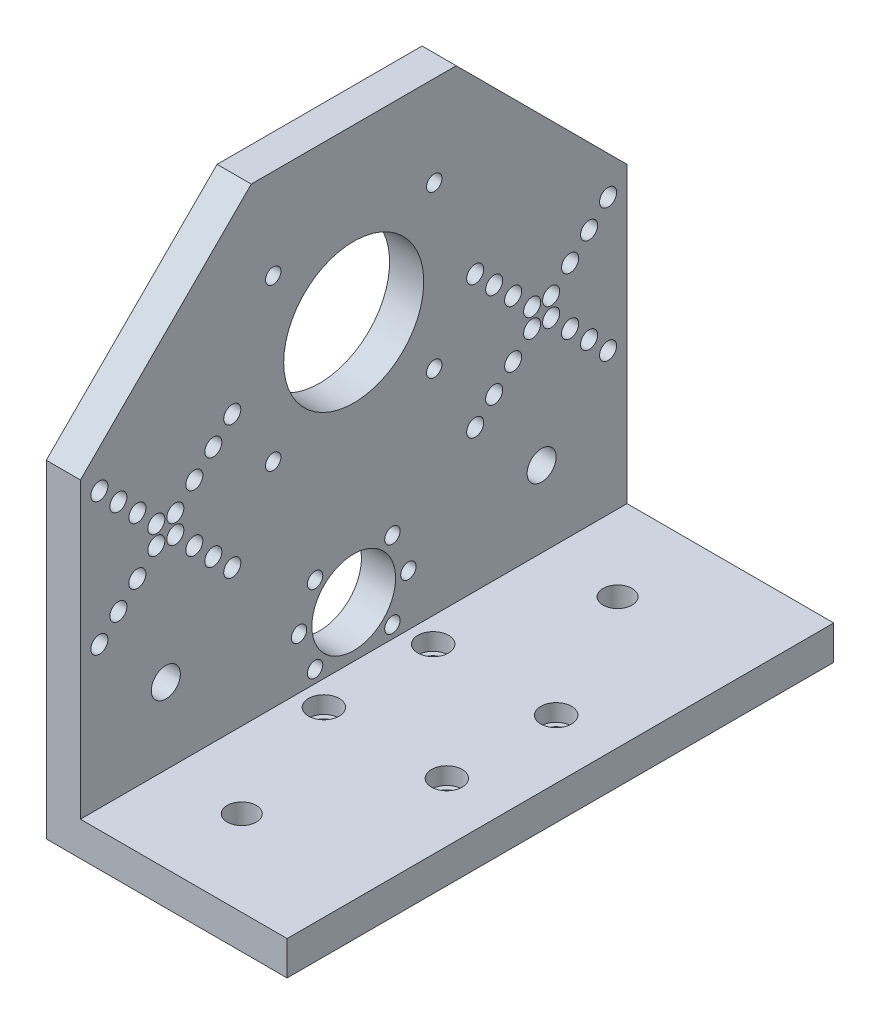
from build123d import *

# Parameters (mm, degrees)
SKETCH1_W           = 70.5
SKETCH1_H           = 60
SKETCH1_R           = 2.95
BOSS_EXTRUDE1_DEPTH = 10
SKETCH3_R           = 4.5
CUT_EXTRUDE1_DEPTH  = 5
SKETCH4_W           = 10
SKETCH4_H           = 60
BOSS_EXTRUDE3_DEPTH = 31
CUT_EXTRUDE2_REACH  = 103.248
SKETCH5_R           = 12.25
SKETCH5_R_2         = 2.25
SKETCH6_W           = 60
SKETCH6_H           = 31
SKETCH6_R           = 8
BOSS_EXTRUDE4_DEPTH = 5
SKETCH7_W           = 70.5
SKETCH7_H           = 60
BOSS_EXTRUDE5_DEPTH = 5
SKETCH8_W           = 60
SKETCH8_H           = 100
SKETCH8_R           = 2.25
SKETCH8_R_2         = 20.5
BOSS_EXTRUDE6_DEPTH = 10
CUT_EXTRUDE3_REACH  = 174.876
SKETCH10_W          = 50
SKETCH10_H          = 96
SKETCH10_R          = 2.5
BOSS_EXTRUDE7_DEPTH = 10
CHAMFER1_SIZE       = 50
SKETCH11_W          = 60.5
SKETCH11_H          = 50
BOSS_EXTRUDE8_DEPTH = 10
CUT_EXTRUDE4_REACH  = 194.552
SKETCH12_R          = 4.25
CUT_EXTRUDE6_REACH  = 190.59
SKETCH14_R          = 4.25


with BuildPart() as part:
    # Sketch1 → Boss-Extrude1 (new body)
    with BuildSketch(Plane(origin=(0, 0, 0), x_dir=(1, 0, 0), z_dir=(0, 1, 0))):
        with Locations((35.25, 30)):
            Rectangle(SKETCH1_W, SKETCH1_H)
        with Locations(Location((53.25, 46, 0), (0, 0, 270))):
            Circle(SKETCH1_R, mode=Mode.SUBTRACT)
        with Locations(Location((53.25, 14, 0), (0, 0, 270))):
            Circle(SKETCH1_R, mode=Mode.SUBTRACT)
        with Locations(Location((17.25, 46, 0), (0, 0, 270))):
            Circle(SKETCH1_R, mode=Mode.SUBTRACT)
        with Locations(Location((17.25, 14, 0), (0, 0, 270))):
            Circle(SKETCH1_R, mode=Mode.SUBTRACT)
    extrude(amount=BOSS_EXTRUDE1_DEPTH)

    # Sketch3 → Cut-Extrude1 (cut)
    with BuildSketch(Plane(origin=(0, 10, 0), x_dir=(1, 0, 0), z_dir=(0, 1, 0))):
        with Locations(Location((53.25, 46, 0), (0, 0, 270))):
            Circle(SKETCH3_R)
        with Locations(Location((53.25, 14, 0), (0, 0, 270))):
            Circle(SKETCH3_R)
        with Locations(Location((17.25, 46, 0), (0, 0, 270))):
            Circle(SKETCH3_R)
        with Locations(Location((17.25, 14, 0), (0, 0, 270))):
            Circle(SKETCH3_R)
    extrude(amount=-CUT_EXTRUDE1_DEPTH, mode=Mode.SUBTRACT)

    # Sketch4 → Boss-Extrude3 (add)
    with BuildSketch(Plane(origin=(0, 10, 0), x_dir=(1, 0, 0), z_dir=(0, 1, 0))):
        with Locations((5, 30)):
            Rectangle(SKETCH4_W, SKETCH4_H)
    extrude(amount=BOSS_EXTRUDE3_DEPTH)

    # Sketch5 → Cut-Extrude2 (cut, up to next)
    with BuildSketch(Plane.ZY, mode=Mode.PRIVATE) as cut_extrude2_sk1:
        with Locations((-30, 25)):
            Circle(SKETCH5_R)
    cut_extrude2_tool1 = extrude(cut_extrude2_sk1.sketch, amount=-CUT_EXTRUDE2_REACH, mode=Mode.PRIVATE) & part.part
    # Sketch5 → Cut-Extrude2 (cut, up to next)
    with BuildSketch(Plane.ZY, mode=Mode.PRIVATE) as cut_extrude2_sk2:
        with Locations((-14, 25)):
            Circle(SKETCH5_R_2)
    cut_extrude2_tool2 = extrude(cut_extrude2_sk2.sketch, amount=-CUT_EXTRUDE2_REACH, mode=Mode.PRIVATE) & part.part
    # Sketch5 → Cut-Extrude2 (cut, up to next)
    with BuildSketch(Plane.ZY, mode=Mode.PRIVATE) as cut_extrude2_sk3:
        with Locations((-18.686291501, 36.313708499)):
            Circle(SKETCH5_R_2)
    cut_extrude2_tool3 = extrude(cut_extrude2_sk3.sketch, amount=-CUT_EXTRUDE2_REACH, mode=Mode.PRIVATE) & part.part
    # Sketch5 → Cut-Extrude2 (cut, up to next)
    with BuildSketch(Plane.ZY, mode=Mode.PRIVATE) as cut_extrude2_sk4:
        with Locations((-18.686291501, 13.686291501)):
            Circle(SKETCH5_R_2)
    cut_extrude2_tool4 = extrude(cut_extrude2_sk4.sketch, amount=-CUT_EXTRUDE2_REACH, mode=Mode.PRIVATE) & part.part
    # Sketch5 → Cut-Extrude2 (cut, up to next)
    with BuildSketch(Plane.ZY, mode=Mode.PRIVATE) as cut_extrude2_sk5:
        with Locations((-41.313708499, 36.313708499)):
            Circle(SKETCH5_R_2)
    cut_extrude2_tool5 = extrude(cut_extrude2_sk5.sketch, amount=-CUT_EXTRUDE2_REACH, mode=Mode.PRIVATE) & part.part
    # Sketch5 → Cut-Extrude2 (cut, up to next)
    with BuildSketch(Plane.ZY, mode=Mode.PRIVATE) as cut_extrude2_sk6:
        with Locations((-46, 25)):
            Circle(SKETCH5_R_2)
    cut_extrude2_tool6 = extrude(cut_extrude2_sk6.sketch, amount=-CUT_EXTRUDE2_REACH, mode=Mode.PRIVATE) & part.part
    # Sketch5 → Cut-Extrude2 (cut, up to next)
    with BuildSketch(Plane.ZY, mode=Mode.PRIVATE) as cut_extrude2_sk7:
        with Locations((-41.313708499, 13.686291501)):
            Circle(SKETCH5_R_2)
    cut_extrude2_tool7 = extrude(cut_extrude2_sk7.sketch, amount=-CUT_EXTRUDE2_REACH, mode=Mode.PRIVATE) & part.part
    add(cut_extrude2_tool1.solids().sort_by_distance((0, 25, -30))[0], mode=Mode.SUBTRACT)
    add(cut_extrude2_tool2.solids().sort_by_distance((0, 25, -14))[0], mode=Mode.SUBTRACT)
    add(cut_extrude2_tool3.solids().sort_by_distance((0, 36.313708, -18.686292))[0], mode=Mode.SUBTRACT)
    add(cut_extrude2_tool4.solids().sort_by_distance((0, 13.686292, -18.686292))[0], mode=Mode.SUBTRACT)
    add(cut_extrude2_tool5.solids().sort_by_distance((0, 36.313708, -41.313708))[0], mode=Mode.SUBTRACT)
    add(cut_extrude2_tool6.solids().sort_by_distance((0, 25, -46))[0], mode=Mode.SUBTRACT)
    add(cut_extrude2_tool7.solids().sort_by_distance((0, 13.686292, -41.313708))[0], mode=Mode.SUBTRACT)

    # Sketch6 → Boss-Extrude4 (add)
    with BuildSketch(Plane(origin=(70.5, 0, 0), x_dir=(0, 0, -1), z_dir=(1, 0, 0))):
        with Locations((30, 25.5)):
            Rectangle(SKETCH6_W, SKETCH6_H)
        with Locations((30, 25)):
            Circle(SKETCH6_R, mode=Mode.SUBTRACT)
    extrude(amount=-BOSS_EXTRUDE4_DEPTH)

    # Sketch7 → Boss-Extrude5 (add)
    with BuildSketch(Plane(origin=(0, 41, 0), x_dir=(1, 0, 0), z_dir=(0, 1, 0))):
        with Locations((35.25, 30)):
            Rectangle(SKETCH7_W, SKETCH7_H)
    extrude(amount=BOSS_EXTRUDE5_DEPTH)

    # Sketch8 → Boss-Extrude6 (add)
    with BuildSketch(Plane.ZY):
        with Locations((-30, 96)):
            Rectangle(SKETCH8_W, SKETCH8_H)
        with Locations((-53.57, 72.43)):
            Circle(SKETCH8_R, mode=Mode.SUBTRACT)
        with Locations((-6.43, 72.43)):
            Circle(SKETCH8_R, mode=Mode.SUBTRACT)
        with Locations((-6.43, 119.57)):
            Circle(SKETCH8_R, mode=Mode.SUBTRACT)
        with Locations((-53.57, 119.57)):
            Circle(SKETCH8_R, mode=Mode.SUBTRACT)
        with Locations((-30, 96)):
            Circle(SKETCH8_R_2, mode=Mode.SUBTRACT)
    extrude(amount=-BOSS_EXTRUDE6_DEPTH)

    # Sketch9 → Cut-Extrude3 (cut, up to next)
    with BuildSketch(Plane.XY, mode=Mode.PRIVATE) as cut_extrude3_sk1:
        Polygon((10, 41), (65.5, 41), (65.5, 10), (70.5, 10), (70.5, 46), (10, 46), align=None)
    cut_extrude3_tool1 = extrude(cut_extrude3_sk1.sketch, amount=-CUT_EXTRUDE3_REACH, mode=Mode.PRIVATE) & part.part
    add(cut_extrude3_tool1.solids().sort_by_distance((37.75, 41.704006, 0))[0], mode=Mode.SUBTRACT)

    # Sketch10 → Boss-Extrude7 (add)
    with BuildSketch(Plane.ZY):
        with Locations((-85, 48)):
            Rectangle(SKETCH10_W, SKETCH10_H)
        with Locations((-65.555555556, 90.444444444)):
            Circle(SKETCH10_R, mode=Mode.SUBTRACT)
        with Locations((-104.444444444, 51.555555556)):
            Circle(SKETCH10_R, mode=Mode.SUBTRACT)
        with Locations((-98.888888889, 57.111111111)):
            Circle(SKETCH10_R, mode=Mode.SUBTRACT)
        with Locations((-93.333333333, 62.666666667)):
            Circle(SKETCH10_R, mode=Mode.SUBTRACT)
        with Locations((-87.777777778, 68.222222222)):
            Circle(SKETCH10_R, mode=Mode.SUBTRACT)
        with Locations((-87.777777778, 73.777777778)):
            Circle(SKETCH10_R, mode=Mode.SUBTRACT)
        with Locations((-98.888888889, 84.888888889)):
            Circle(SKETCH10_R, mode=Mode.SUBTRACT)
        with Locations((-104.444444444, 90.444444444)):
            Circle(SKETCH10_R, mode=Mode.SUBTRACT)
        with Locations((-93.333333333, 79.333333333)):
            Circle(SKETCH10_R, mode=Mode.SUBTRACT)
        with Locations((-82.222222222, 68.222222222)):
            Circle(SKETCH10_R, mode=Mode.SUBTRACT)
        with Locations((-82.222222222, 73.777777778)):
            Circle(SKETCH10_R, mode=Mode.SUBTRACT)
        with Locations((-76.666666667, 62.666666667)):
            Circle(SKETCH10_R, mode=Mode.SUBTRACT)
        with Locations((-65.555555556, 51.555555556)):
            Circle(SKETCH10_R, mode=Mode.SUBTRACT)
        with Locations((-71.111111111, 57.111111111)):
            Circle(SKETCH10_R, mode=Mode.SUBTRACT)
        with Locations((-76.666666667, 79.333333333)):
            Circle(SKETCH10_R, mode=Mode.SUBTRACT)
        with Locations((-71.111111111, 84.888888889)):
            Circle(SKETCH10_R, mode=Mode.SUBTRACT)
    extrude(amount=-BOSS_EXTRUDE7_DEPTH)

    # Chamfer1
    chamfer1_edges = [part.edges().sort_by_distance(p)[0] for p in [
        (5, 96, -60),
    ]]
    chamfer(chamfer1_edges, length=CHAMFER1_SIZE - 0.0001)  # a hair under: the kernel refuses the full size

    # Sketch11 → Boss-Extrude8 (add)
    with BuildSketch(Plane(origin=(0, 10, 0), x_dir=(1, 0, 0), z_dir=(0, 1, 0))):
        with Locations((40.25, 85)):
            Rectangle(SKETCH11_W, SKETCH11_H)
    extrude(amount=-BOSS_EXTRUDE8_DEPTH)

    # Sketch12 → Cut-Extrude4 (cut, up to next)
    with BuildSketch(Plane(origin=(10, 0, 0), x_dir=(0, 0, -1), z_dir=(1, 0, 0)), mode=Mode.PRIVATE) as cut_extrude4_sk1:
        with Locations((85, 32.225)):
            Circle(SKETCH12_R)
    cut_extrude4_tool1 = extrude(cut_extrude4_sk1.sketch, amount=-CUT_EXTRUDE4_REACH, mode=Mode.PRIVATE) & part.part
    add(cut_extrude4_tool1.solids().sort_by_distance((10, 32.225, -85))[0], mode=Mode.SUBTRACT)

    # Sketch14 → Cut-Extrude6 (cut, up to next)
    with BuildSketch(Plane(origin=(0, 10, 0), x_dir=(1, 0, 0), z_dir=(0, 1, 0)), mode=Mode.PRIVATE) as cut_extrude6_sk1:
        with Locations(Location((32.225, 85, 0), (0, 0, 270))):
            Circle(SKETCH14_R)
    cut_extrude6_tool1 = extrude(cut_extrude6_sk1.sketch, amount=-CUT_EXTRUDE6_REACH, mode=Mode.PRIVATE) & part.part
    add(cut_extrude6_tool1.solids().sort_by_distance((32.225, 10, -85))[0], mode=Mode.SUBTRACT)

    # Mirror1: part across plane


with BuildPart() as part_1:
    add(part.part)
    add(part.part.mirror(Plane.XY.offset(-30)))


solid = part_1.part
